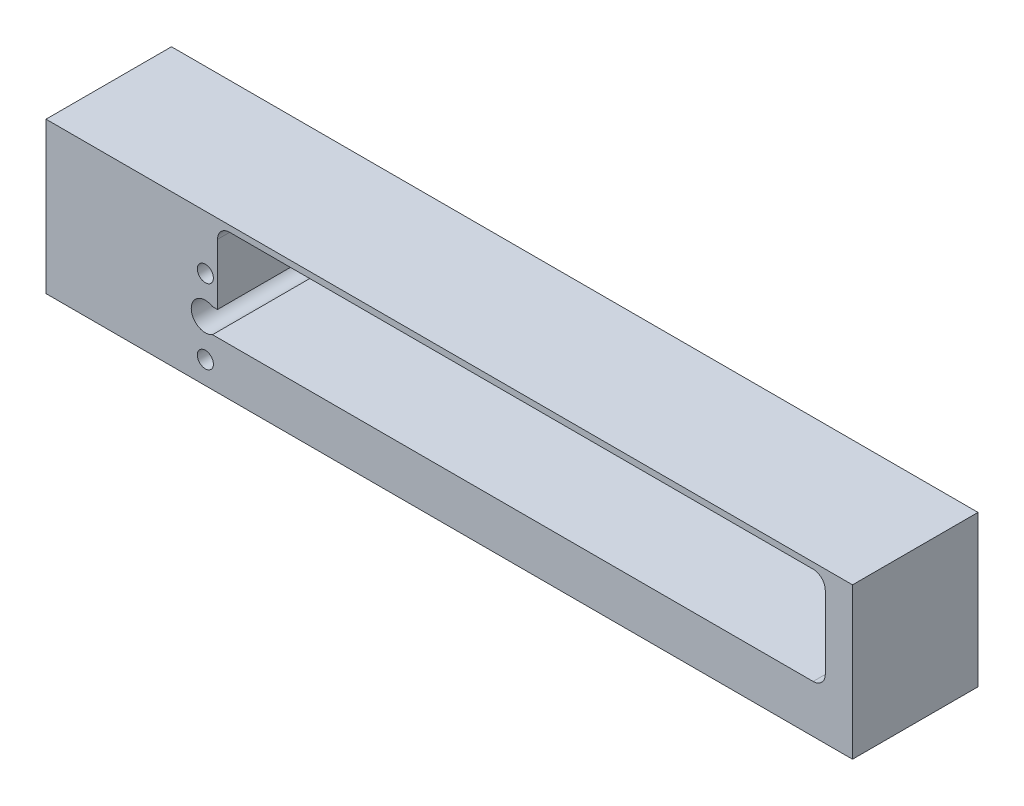
from build123d import *

# Parameters (mm, degrees)
SKETCH1_R           = 20.52
SKETCH1_R_2         = 36
BOSS_EXTRUDE1_DEPTH = 320
CUT_EXTRUDE1_START  = -310
CUT_EXTRUDE1_DEPTH  = 310


with BuildPart() as part:
    # Sketch1 → Boss-Extrude1 (new body)
    with BuildSketch(Plane.XY):
        Polygon((-406.4, 152.64), (-406.4, -152.64), (406.4, -152.64), (1650.508092605, -152.64), (1650.508092605, 232.64), (-406.4, 232.64), align=None)
        with Locations((0, -95.04)):
            Circle(SKETCH1_R, mode=Mode.SUBTRACT)
        Circle(SKETCH1_R_2, mode=Mode.SUBTRACT)
        with BuildLine():
            ThreePointArc((0, 115.56), (14.50983115, 109.54983115), (20.52, 95.04))
            ThreePointArc((20.52, 95.04), (-14.50983115, 80.53016885), (0, 115.56))
        make_face(mode=Mode.SUBTRACT)
    extrude(amount=BOSS_EXTRUDE1_DEPTH)

    # Sketch2 → Cut-Extrude1 (cut)
    with BuildSketch(Plane.XY.offset(320).offset(CUT_EXTRUDE1_START)):
        with BuildLine():
            ThreePointArc((1550, -31), (1571.920310217, -21.920310217), (1581, 0))
            Line((1581, 0), (1581, 186))
            ThreePointArc((1581, 186), (1571.920310217, 207.920310217), (1550, 217))
            Line((1550, 217), (62, 217))
            ThreePointArc((62, 217), (40.079689783, 207.920310217), (31, 186))
            Line((31, 186), (31, 53.469630572))
            Line((31, 53.469630572), (31, 31))
            Line((31, 31), (18.303005218, 31))
            ThreePointArc((18.303005218, 31), (31.264262248, 17.847854383), (36, 0))
            ThreePointArc((36, 0), (31.264262248, -17.847854383), (18.303005218, -31))
            Line((18.303005218, -31), (1550, -31))
        make_face()
    extrude(amount=CUT_EXTRUDE1_DEPTH, mode=Mode.SUBTRACT)


solid = part.part
